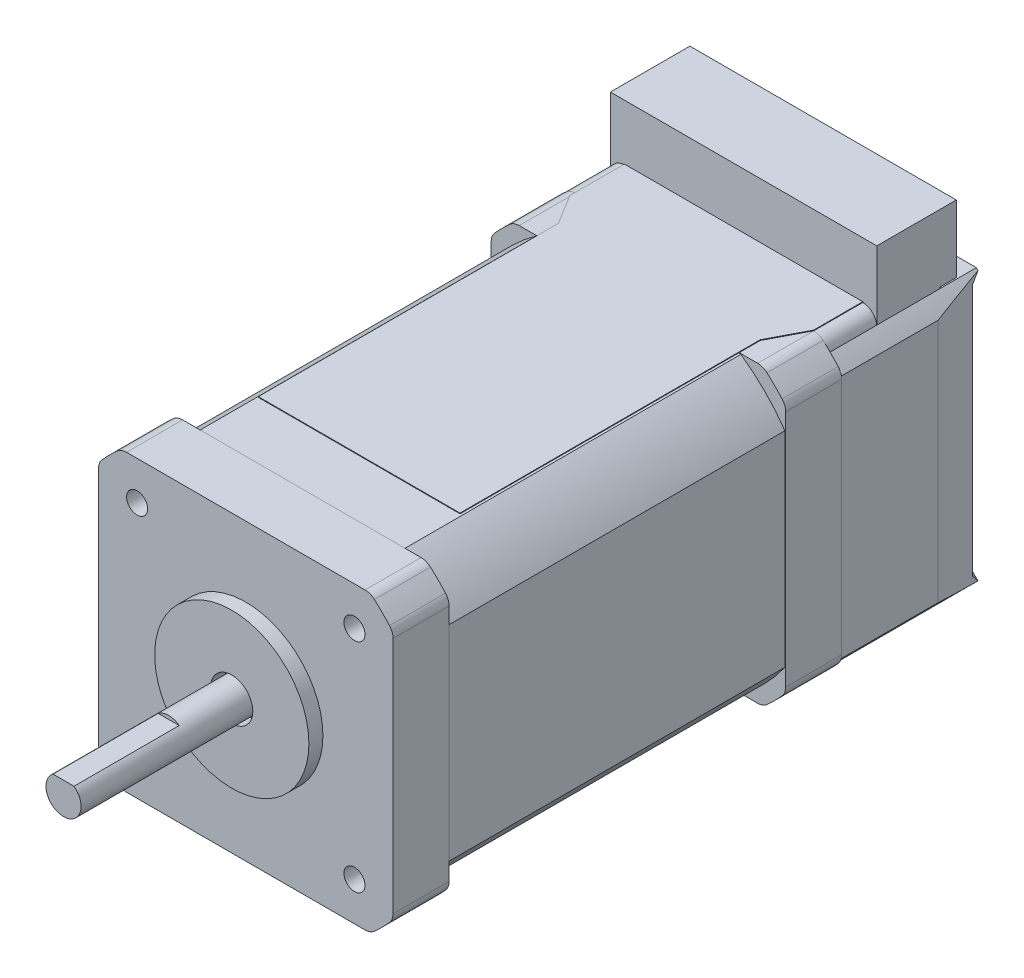
from build123d import *

# Parameters (mm, degrees)
SKIZZE1_W                            = 42
SKIZZE1_H                            = 42
AUFSATZ_LINEAR_AUSTRAGEN1_DEPTH      = 32
SKIZZE3_R                            = 11
SKIZZE3_R_2                          = 3
AUFSATZ_LINEAR_AUSTRAGEN2_DEPTH      = 2
SKIZZE5_R                            = 1.5
SCHNITT_LINEAR_AUSTRAGEN2_DEPTH      = 10
AUFSATZ_LINEAR_AUSTRAGEN3_DEPTH      = 24
AUFSATZ_LINEAR_AUSTRAGEN3_DEPTH_BACK = 10
SKIZZE6_R                            = 2.5
SKIZZE10_W                           = 14.352369787
SKIZZE10_H                           = 9.568246525
SCHNITT_LINEAR_AUSTRAGEN4_DEPTH      = 15
SKIZZE2_OUTSIDE_W                    = 65.566
SKIZZE2_OUTSIDE_H                    = 65.566
SKIZZE2_OUTSIDE_R                    = 27.5
SCHNITT_LINEAR_AUSTRAGEN5_DEPTH      = 71.554943129
SCHNITT_LINEAR_START                 = -8
SKIZZE11_R                           = 28.22533159
SCHNITT_LINEAR_AUSTRAGEN6_DEPTH      = 48
VERRUNDUNG1_R                        = 2
SKIZZE12_W                           = 38
SKIZZE12_H                           = 15
AUFSATZ_LINEAR_AUSTRAGEN4_DEPTH      = 8
VERRUNDUNG2_R                        = 2
SKIZZE13_W                           = 38
SKIZZE13_H                           = 13
AUFSATZ_LINEAR_AUSTRAGEN5_DEPTH      = 8
SKIZZE15_W                           = 2.5
SKIZZE15_H                           = 6.8
SCHNITT_LINEAR_AUSTRAGEN7_DEPTH      = 8
LINEARES_MUSTER1_COUNT               = 5
LINEARES_MUSTER1_PITCH               = 3.5
SPIEGELN1_COPY_1_SKETCH_W            = 2.5
SPIEGELN1_COPY_1_SKETCH_H            = 6.8
SPIEGELN1_COPY_1_DEPTH               = 8
SPIEGELN1_COPY_2_SKETCH_W            = 2.5
SPIEGELN1_COPY_2_SKETCH_H            = 6.8
SPIEGELN1_COPY_2_DEPTH               = 8
SPIEGELN1_COPY_3_SKETCH_W            = 2.5
SPIEGELN1_COPY_3_SKETCH_H            = 6.8
SPIEGELN1_COPY_3_DEPTH               = 8
SPIEGELN1_COPY_4_SKETCH_W            = 2.5
SPIEGELN1_COPY_4_SKETCH_H            = 6.8
SPIEGELN1_COPY_4_DEPTH               = 8
AUFSATZ_LINEAR_AUSTRAGEN6_DEPTH      = 16
AUFSATZ_LINEAR_AUSTRAGEN7_DEPTH      = 5
SCHNITT_LINEAR_AUSTRAGEN8_DEPTH      = 1
AUFSATZ_LINEAR_AUSTRAGEN8_DEPTH      = 1
SCHNITT_LINEAR_AUSTRAGEN9_DEPTH      = 1
FASE1_SIZE                           = 1
SCHNITT_LINEAR_AUSTRAGEN10_DEPTH     = 74.741195116
SKIZZE22_R                           = 3
SCHNITT_LINEAR_AUSTRAGEN11_DEPTH     = 2
AUFSATZ_LINEAR_AUSTRAGEN9_DEPTH      = 0.1
SKIZZE24_W                           = 38
SKIZZE24_H                           = 11.340652338
AUFSATZ_LINEAR_AUSTRAGEN10_DEPTH     = 10


with BuildPart() as part:
    # Skizze1 → Aufsatz-Linear austragen1 (new, symmetric)
    with BuildSketch(Plane.XY):
        Rectangle(SKIZZE1_W, SKIZZE1_H)
    extrude(amount=AUFSATZ_LINEAR_AUSTRAGEN1_DEPTH, both=True)

    # Skizze3 → Aufsatz-Linear austragen2 (add)
    with BuildSketch(Plane.XY.offset(32)):
        Circle(SKIZZE3_R)
        Circle(SKIZZE3_R_2, mode=Mode.SUBTRACT)
    extrude(amount=AUFSATZ_LINEAR_AUSTRAGEN2_DEPTH)

    # Skizze5 → Schnitt-Linear austragen2 (cut)
    with BuildSketch(Plane.XY.offset(32)):
        with Locations((-15.5, 15.5)):
            Circle(SKIZZE5_R)
        with Locations((15.5, 15.5)):
            Circle(SKIZZE5_R)
        with Locations((-15.5, -15.5)):
            Circle(SKIZZE5_R)
        with Locations((15.5, -15.5)):
            Circle(SKIZZE5_R)
    extrude(amount=-SCHNITT_LINEAR_AUSTRAGEN2_DEPTH, mode=Mode.SUBTRACT)

    # Skizze6 → Aufsatz-Linear austragen3 (add, two sides: drawn at the far end of the back side and taken through both)
    with BuildSketch(Plane.XY.offset(34).offset(-AUFSATZ_LINEAR_AUSTRAGEN3_DEPTH_BACK)):
        Circle(SKIZZE6_R)
    extrude(amount=AUFSATZ_LINEAR_AUSTRAGEN3_DEPTH + AUFSATZ_LINEAR_AUSTRAGEN3_DEPTH_BACK)

    # Skizze10 → Schnitt-Linear austragen4 (cut)
    with BuildSketch(Plane.XY.offset(58)):
        with Locations((0.401216994, 6.784123263)):
            Rectangle(SKIZZE10_W, SKIZZE10_H)
    extrude(amount=-SCHNITT_LINEAR_AUSTRAGEN4_DEPTH, mode=Mode.SUBTRACT)

    # Skizze2 outside → Schnitt-Linear austragen5 (cut, through all)
    with BuildSketch(Plane.XY.offset(32)):
        Rectangle(SKIZZE2_OUTSIDE_W, SKIZZE2_OUTSIDE_H)
        Circle(SKIZZE2_OUTSIDE_R, mode=Mode.SUBTRACT)
    extrude(amount=-SCHNITT_LINEAR_AUSTRAGEN5_DEPTH, mode=Mode.SUBTRACT)

    # Skizze11 → Schnitt-Linear austragen6 (cut)
    with BuildSketch(Plane.XY.offset(32).offset(SCHNITT_LINEAR_START)):
        Circle(SKIZZE11_R)
        with BuildLine():
            Line((-14.609585894, 20.9), (14.609585894, 20.9))
            ThreePointArc((14.609585894, 20.9), (18.03122292, 18.03122292), (20.9, 14.609585894))
            Line((20.9, 14.609585894), (20.9, -14.609585894))
            ThreePointArc((20.9, -14.609585894), (18.03122292, -18.03122292), (14.609585894, -20.9))
            Line((14.609585894, -20.9), (-14.609585894, -20.9))
            ThreePointArc((-14.609585894, -20.9), (-18.03122292, -18.03122292), (-20.9, -14.609585894))
            Line((-20.9, -14.609585894), (-20.9, 14.609585894))
            ThreePointArc((-20.9, 14.609585894), (-18.03122292, 18.03122292), (-14.609585894, 20.9))
        make_face(mode=Mode.SUBTRACT)
    extrude(amount=-SCHNITT_LINEAR_AUSTRAGEN6_DEPTH, mode=Mode.SUBTRACT)

    # Verrundung1
    verrundung1_edges = [part.edges().sort_by_distance(p)[0] for p in [
        (-17.755280905, 21, -28),
        (-21, 17.755280905, 28),
        (21, 17.755280905, -28),
        (17.755280905, 21, 28),
        (21, -17.755280905, 28),
        (17.755280905, -21, -28),
        (-21, -17.755280905, -28),
        (-17.755280905, -21, 28),
        (21, -17.755280905, -28),
        (21, 17.755280905, 28),
        (17.755280905, 21, -28),
        (-17.755280905, 21, 28),
        (-21, 17.755280905, -28),
        (-21, -17.755280905, 28),
        (-17.755280905, -21, -28),
        (17.755280905, -21, 28),
    ]]
    fillet(verrundung1_edges, radius=VERRUNDUNG1_R)



with BuildPart() as body_2:
    # Skizze12 → Aufsatz-Linear austragen4 (new body)
    with BuildSketch(Plane(origin=(0, 0, -32), x_dir=(-1, 0, 0), z_dir=(0, 0, -1))):
        with Locations((0, 13.5)):
            Rectangle(SKIZZE12_W, SKIZZE12_H)
    extrude(amount=AUFSATZ_LINEAR_AUSTRAGEN4_DEPTH)

    # Verrundung2
    verrundung2_edges = [body_2.edges().sort_by_distance(p)[0] for p in [
        (19, 21, -36),
        (-19, 21, -36),
    ]]
    fillet(verrundung2_edges, radius=VERRUNDUNG2_R)


with BuildPart() as body_3:
    # Skizze13 → Aufsatz-Linear austragen5 (new body)
    with BuildSketch(Plane(origin=(0, 0, -40), x_dir=(-1, 0, 0), z_dir=(0, 0, -1))):
        with Locations((0, 12.5)):
            Rectangle(SKIZZE13_W, SKIZZE13_H)
    extrude(amount=AUFSATZ_LINEAR_AUSTRAGEN5_DEPTH)

    # Skizze15 → Schnitt-Linear austragen7 (cut)
    with BuildSketch(Plane(origin=(0, 19, 0), x_dir=(1, 0, 0), z_dir=(0, 1, 0))):
        with Locations((1.75, 44)):
            Rectangle(SKIZZE15_W, SKIZZE15_H)
    schnitt_linear_austragen7 = extrude(amount=-SCHNITT_LINEAR_AUSTRAGEN7_DEPTH, mode=Mode.SUBTRACT)

    # Lineares Muster1: Schnitt-Linear austragen7 ×5
    with Locations(*[(i * LINEARES_MUSTER1_PITCH, 0, 0) for i in range(1, LINEARES_MUSTER1_COUNT)]):
        add(schnitt_linear_austragen7, mode=Mode.SUBTRACT)

    # Spiegeln1: Schnitt-Linear austragen7 across plane
    add(schnitt_linear_austragen7.mirror(Plane(origin=(0, 0, 0), x_dir=(0, 0, 1), z_dir=(1, 0, 0))), mode=Mode.SUBTRACT)

    # Spiegeln1 copy 1 sketch → Spiegeln1 copy 1 (cut)
    with BuildSketch(Plane(origin=(-3.5, 19, 0), x_dir=(-1, 0, 0), z_dir=(0, 1, 0))):
        with Locations((1.75, -44)):
            Rectangle(SPIEGELN1_COPY_1_SKETCH_W, SPIEGELN1_COPY_1_SKETCH_H)
    extrude(amount=-SPIEGELN1_COPY_1_DEPTH, mode=Mode.SUBTRACT)

    # Spiegeln1 copy 2 sketch → Spiegeln1 copy 2 (cut)
    with BuildSketch(Plane(origin=(-7, 19, 0), x_dir=(-1, 0, 0), z_dir=(0, 1, 0))):
        with Locations((1.75, -44)):
            Rectangle(SPIEGELN1_COPY_2_SKETCH_W, SPIEGELN1_COPY_2_SKETCH_H)
    extrude(amount=-SPIEGELN1_COPY_2_DEPTH, mode=Mode.SUBTRACT)

    # Spiegeln1 copy 3 sketch → Spiegeln1 copy 3 (cut)
    with BuildSketch(Plane(origin=(-10.5, 19, 0), x_dir=(-1, 0, 0), z_dir=(0, 1, 0))):
        with Locations((1.75, -44)):
            Rectangle(SPIEGELN1_COPY_3_SKETCH_W, SPIEGELN1_COPY_3_SKETCH_H)
    extrude(amount=-SPIEGELN1_COPY_3_DEPTH, mode=Mode.SUBTRACT)

    # Spiegeln1 copy 4 sketch → Spiegeln1 copy 4 (cut)
    with BuildSketch(Plane(origin=(-14, 19, 0), x_dir=(-1, 0, 0), z_dir=(0, 1, 0))):
        with Locations((1.75, -44)):
            Rectangle(SPIEGELN1_COPY_4_SKETCH_W, SPIEGELN1_COPY_4_SKETCH_H)
    extrude(amount=-SPIEGELN1_COPY_4_DEPTH, mode=Mode.SUBTRACT)



with BuildPart() as body_4:
    # Skizze16 → Aufsatz-Linear austragen6 (new body)
    with BuildSketch(Plane(origin=(0, 0, -32), x_dir=(-1, 0, 0), z_dir=(0, 0, -1))):
        with BuildLine():
            Line((-19.2, 19.407472788), (-19.2, 5.707374331))
            Line((-19.2, 5.707374331), (19.2, 5.707374331))
            Line((19.2, 5.707374331), (19.2, 19.407472788))
            ThreePointArc((19.2, 19.407472788), (20.123963193, 18.447658534), (21, 17.443910112))
            Line((21, 17.443910112), (21, -17.443910112))
            ThreePointArc((21, -17.443910112), (19.304015126, -19.304015126), (17.443910112, -21))
            Line((17.443910112, -21), (-17.443910112, -21))
            ThreePointArc((-17.443910112, -21), (-19.304015126, -19.304015126), (-21, -17.443910112))
            Line((-21, -17.443910112), (-21, 17.443910112))
            ThreePointArc((-21, 17.443910112), (-20.123963193, 18.447658534), (-19.2, 19.407472788))
        make_face()
    extrude(amount=AUFSATZ_LINEAR_AUSTRAGEN6_DEPTH)


with BuildPart() as body_3_1:
    add(body_3.part)

    add(body_4.part)  # Aufsatz-Linear austragen7 merges body 4
    # Skizze17 → Aufsatz-Linear austragen7 (add)
    with BuildSketch(Plane(origin=(0, 0, -48), x_dir=(-1, 0, 0), z_dir=(0, 0, -1))):
        with BuildLine():
            Line((-19.2, 19.407472788), (19.2, 19.407472788))
            ThreePointArc((19.2, 19.407472788), (20.123963193, 18.447658534), (21, 17.443910112))
            Line((21, 17.443910112), (21, -17.443910112))
            ThreePointArc((21, -17.443910112), (19.304015126, -19.304015126), (17.443910112, -21))
            Line((17.443910112, -21), (-17.443910112, -21))
            ThreePointArc((-17.443910112, -21), (-19.304015126, -19.304015126), (-21, -17.443910112))
            Line((-21, -17.443910112), (-21, 17.443910112))
            ThreePointArc((-21, 17.443910112), (-20.123963193, 18.447658534), (-19.2, 19.407472788))
        make_face()
    extrude(amount=AUFSATZ_LINEAR_AUSTRAGEN7_DEPTH)

    # Skizze18 → Schnitt-Linear austragen8 (cut)
    with BuildSketch(Plane(origin=(0, 0, -53), x_dir=(-1, 0, 0), z_dir=(0, 0, -1))):
        with BuildLine():
            Line((5.221122562, 2.334373984), (5.221122562, -9.553971573))
            ThreePointArc((5.221122562, -9.553971573), (4.489595038, -12.219240265), (2.5, -14.137651406))
            Line((2.5, -14.137651406), (2.5, -14.933283778))
            Line((2.5, -14.933283778), (8.566716222, -21))
            Line((8.566716222, -21), (-8.566716222, -21))
            Line((-8.566716222, -21), (-2.5, -14.933283778))
            Line((-2.5, -14.933283778), (-2.5, -14.137651406))
            ThreePointArc((-2.5, -14.137651406), (-4.489595038, -12.219240265), (-5.221122562, -9.553971573))
            Line((-5.221122562, -9.553971573), (-5.221122562, 2.334373984))
            ThreePointArc((-5.221122562, 2.334373984), (-4.489595038, 4.999642676), (-2.5, 6.918053817))
            Line((-2.5, 6.918053817), (-2.5, 12.218156322))
            Line((-2.5, 12.218156322), (-9.689316465, 19.407472788))
            Line((-9.689316465, 19.407472788), (9.689316465, 19.407472788))
            Line((9.689316465, 19.407472788), (2.5, 12.218156322))
            Line((2.5, 12.218156322), (2.5, 6.918053817))
            ThreePointArc((2.5, 6.918053817), (4.489595038, 4.999642676), (5.221122562, 2.334373984))
        make_face()
    extrude(amount=-SCHNITT_LINEAR_AUSTRAGEN8_DEPTH, mode=Mode.SUBTRACT)

    # Skizze19 → Aufsatz-Linear austragen8 (add)
    with BuildSketch(Plane(origin=(0, 0, -52), x_dir=(-1, 0, 0), z_dir=(0, 0, -1))):
        with BuildLine():
            Line((-0.773813228, 7.978989317), (-0.773813228, 11.016994269))
            ThreePointArc((-0.773813228, 11.016994269), (0, 11.790807497), (0.773813228, 11.016994269))
            Line((0.773813228, 11.016994269), (0.773813228, 7.978989317))
            ThreePointArc((0.773813228, 7.978989317), (0, 7.20517609), (-0.773813228, 7.978989317))
        make_face()
    extrude(amount=AUFSATZ_LINEAR_AUSTRAGEN8_DEPTH)

    # Skizze20 → Schnitt-Linear austragen9 (cut)
    with BuildSketch(Plane(origin=(0, 0, -53), x_dir=(-1, 0, 0), z_dir=(0, 0, -1))):
        Polygon((-11.644380446, 10.674415981), (-11.644380446, -9.968075788), (-20.123963193, -18.447658534), (-24.141940887, -18.447658534), (-24.141940887, 18.447658534), (-20.123963193, 18.447658534), align=None)
    schnitt_linear_austragen9 = extrude(amount=-SCHNITT_LINEAR_AUSTRAGEN9_DEPTH, mode=Mode.SUBTRACT)

    # Spiegeln2: Schnitt-Linear austragen9 across plane
    add(schnitt_linear_austragen9.mirror(Plane(origin=(0, 0, 0), x_dir=(0, 0, 1), z_dir=(1, 0, 0))), mode=Mode.SUBTRACT)

    # Fase1
    fase1_edges = [body_3_1.edges().sort_by_distance(p)[0] for p in [
        (15.88417182, -14.207867161, -53),
    ]]
    chamfer(fase1_edges, length=FASE1_SIZE - 0.0001)  # a hair under: the kernel refuses the full size
    fase1_2_edges = [body_3_1.edges().sort_by_distance(p)[0] for p in [
        (5.533358111, -17.966641889, -53),
    ]]
    chamfer(fase1_2_edges, length=FASE1_SIZE - 0.0001)  # a hair under: the kernel refuses the full size
    fase1_3_edges = [body_3_1.edges().sort_by_distance(p)[0] for p in [
        (4.600407561, -12.023054617, -53),
        (5.221122562, -3.609798794, -53),
        (4.489595038, 4.999642676, -53),
    ]]
    chamfer(fase1_3_edges, length=FASE1_SIZE - 0.0001)  # a hair under: the kernel refuses the full size
    fase1_4_edges = [body_3_1.edges().sort_by_distance(p)[0] for p in [
        (2.5, 10.124559455, -53),
    ]]
    chamfer(fase1_4_edges, length=FASE1_SIZE - 0.0001)  # a hair under: the kernel refuses the full size
    fase1_5_edges = [body_3_1.edges().sort_by_distance(p)[0] for p in [
        (6.594608233, 16.312764555, -53),
    ]]
    chamfer(fase1_5_edges, length=FASE1_SIZE - 0.0001)  # a hair under: the kernel refuses the full size
    fase1_6_edges = [body_3_1.edges().sort_by_distance(p)[0] for p in [
        (15.88417182, 14.561037258, -53),
    ]]
    chamfer(fase1_6_edges, length=FASE1_SIZE - 0.0001)  # a hair under: the kernel refuses the full size
    fase1_7_edges = [body_3_1.edges().sort_by_distance(p)[0] for p in [
        (11.644380446, 0.353170097, -53),
    ]]
    chamfer(fase1_7_edges, length=FASE1_SIZE - 0.0001)  # a hair under: the kernel refuses the full size
    fase1_8_edges = [body_3_1.edges().sort_by_distance(p)[0] for p in [
        (-5.533358111, -17.966641889, -53),
    ]]
    chamfer(fase1_8_edges, length=FASE1_SIZE - 0.0001)  # a hair under: the kernel refuses the full size
    fase1_9_edges = [body_3_1.edges().sort_by_distance(p)[0] for p in [
        (-15.88417182, -14.207867161, -53),
    ]]
    chamfer(fase1_9_edges, length=FASE1_SIZE - 0.0001)  # a hair under: the kernel refuses the full size
    fase1_10_edges = [body_3_1.edges().sort_by_distance(p)[0] for p in [
        (-11.644380446, 0.353170097, -53),
    ]]
    chamfer(fase1_10_edges, length=FASE1_SIZE - 0.0001)  # a hair under: the kernel refuses the full size
    fase1_11_edges = [body_3_1.edges().sort_by_distance(p)[0] for p in [
        (-15.88417182, 14.561037258, -53),
    ]]
    chamfer(fase1_11_edges, length=FASE1_SIZE - 0.0001)  # a hair under: the kernel refuses the full size
    fase1_12_edges = [body_3_1.edges().sort_by_distance(p)[0] for p in [
        (-6.094658233, 15.812814555, -53),
    ]]
    chamfer(fase1_12_edges, length=FASE1_SIZE - 0.0001)  # a hair under: the kernel refuses the full size
    fase1_13_edges = [body_3_1.edges().sort_by_distance(p)[0] for p in [
        (-2.5, 8.861068999, -53),
    ]]
    chamfer(fase1_13_edges, length=FASE1_SIZE - 0.0001)  # a hair under: the kernel refuses the full size
    fase1_14_edges = [body_3_1.edges().sort_by_distance(p)[0] for p in [
        (-4.77145301, 4.454127974, -53),
        (-5.221122562, -3.609798794, -53),
        (-4.600407561, -12.023054617, -53),
    ]]
    chamfer(fase1_14_edges, length=FASE1_SIZE - 0.0001)  # a hair under: the kernel refuses the full size

    # Skizze21 → Schnitt-Linear austragen10 (cut, through all)
    with BuildSketch(Plane(origin=(0, 19.407472788, 0), x_dir=(1, 0, 0), z_dir=(0, 1, 0))):
        Polygon((19.434719493, 53), (21.463760795, 43.612745604), (21.463760795, 53), align=None)
        Polygon((-19.434719493, 53), (-21.350982399, 43.773225295), (-21.350982399, 53), align=None)
    extrude(amount=-SCHNITT_LINEAR_AUSTRAGEN10_DEPTH, mode=Mode.SUBTRACT)

    # Skizze22 → Schnitt-Linear austragen11 (cut)
    with BuildSketch(Plane(origin=(0, 0, -53), x_dir=(-1, 0, 0), z_dir=(0, 0, -1))):
        with Locations((-15.818432524, 4.576251415)):
            Circle(SKIZZE22_R)
        with Locations((16.158502976, -12.029796634)):
            Circle(SKIZZE22_R)
    extrude(amount=-SCHNITT_LINEAR_AUSTRAGEN11_DEPTH, mode=Mode.SUBTRACT)


with BuildPart() as part_1:
    add(part.part)

    add(body_2.part)  # Aufsatz-Linear austragen9 merges body 2
    # Skizze23 → Aufsatz-Linear austragen9 (add)
    with BuildSketch(Plane(origin=(0, 21, 0), x_dir=(1, 0, 0), z_dir=(0, 1, 0))):
        Polygon((-17, 40), (-17.007351352, 31.216500509), (-14.386369702, 26.989211678), (-14.386369702, -15.82451497), (14.37981527, -15.82451497), (14.37981527, 26.989211678), (17, 32), (17, 40), align=None)
    extrude(amount=AUFSATZ_LINEAR_AUSTRAGEN9_DEPTH)


with BuildPart() as body_3_2:
    # Skizze24 → Aufsatz-Linear austragen10 (new body)
    with BuildSketch(Plane(origin=(0, 19, 0), x_dir=(1, 0, 0), z_dir=(0, 1, 0))):
        with Locations((0, 44.670326169)):
            Rectangle(SKIZZE24_W, SKIZZE24_H)
    extrude(amount=AUFSATZ_LINEAR_AUSTRAGEN10_DEPTH)


solid = Compound([body_3_1.part, part_1.part, body_3_2.part])
